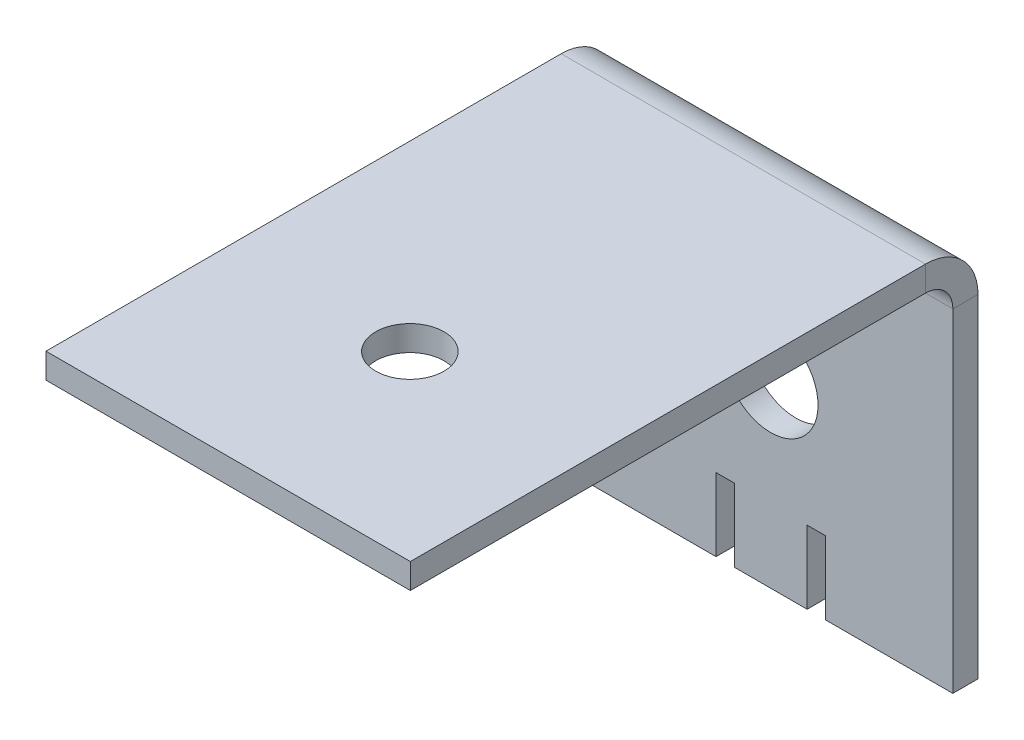
from build123d import *

# Parameters (mm, degrees)
SKETCH1_W              = 25.4
SKETCH1_H              = 63.5
BASE_FLANGE1_DEPTH     = 1.7526
SKETCHED_BEND1_DEPTH   = 25.4
SKETCHED_BEND1_2_DEPTH = 25.4
CUT_EXTRUDE2_REACH     = 54.894
SKETCH9_R              = 3.302
SKETCH9_W              = 1.27
SKETCH9_H              = 5.08
SKETCH10_W             = 5.08
SKETCH10_H             = 5.08
BOSS_EXTRUDE1_DEPTH    = 1.7526
CUT_EXTRUDE3_REACH     = 54.894
SKETCH11_R             = 2.38125


# Read off the part's stored shape, not the designer's step: Sketched Bend1
# Sheet-metal steps are written as plain solids
with BuildPart() as part:
    # Sketch1 → Base-Flange1 (new body)
    with BuildSketch(Plane.XY):
        with Locations((12.7, 31.75)):
            Rectangle(SKETCH1_W, SKETCH1_H)
    extrude(amount=-BASE_FLANGE1_DEPTH)

    # Sketched Bend1 outline → Sketched Bend1 (cut)
    with BuildSketch(Plane.YZ):
        with BuildLine():
            Line((63.5, 0), (26.337912998, 0))
            ThreePointArc((26.337912998, 0), (25.005866723, -1.284495709), (23.215572088, -1.7526))
            Line((23.215572088, -1.7526), (63.5, -1.7526))
            Line((63.5, -1.7526), (63.5, 0))
        make_face()
    extrude(amount=SKETCHED_BEND1_DEPTH, mode=Mode.SUBTRACT)

    # Sketched Bend1 2 outline → Sketched Bend1 2 (add)
    with BuildSketch(Plane.YZ):
        with BuildLine():
            Line((25.120572088, 37.820572088), (25.120572088, 1.905))
            ThreePointArc((25.120572088, 1.905), (24.562610506, 0.557961582), (23.215572088, 0))
            Line((23.215572088, 0), (26.337912998, 0))
            ThreePointArc((26.337912998, 0), (26.736815609, 0.915615432), (26.873172088, 1.905))
            Line((26.873172088, 1.905), (26.873172088, 37.820572088))
            Line((26.873172088, 37.820572088), (25.120572088, 37.820572088))
        make_face()
    extrude(amount=SKETCHED_BEND1_2_DEPTH)

    # Sketch9 → Cut-Extrude2 (cut, up to next)
    with BuildSketch(Plane.XY, mode=Mode.PRIVATE) as cut_extrude2_sk1:
        with Locations((12.7, 12.7)):
            Circle(SKETCH9_R)
    cut_extrude2_tool1 = extrude(cut_extrude2_sk1.sketch, amount=-CUT_EXTRUDE2_REACH, mode=Mode.PRIVATE) & part.part
    # Sketch9 → Cut-Extrude2 (cut, up to next)
    with BuildSketch(Plane.XY, mode=Mode.PRIVATE) as cut_extrude2_sk2:
        with Locations((15.875, 2.54)):
            Rectangle(SKETCH9_W, SKETCH9_H)
    cut_extrude2_tool2 = extrude(cut_extrude2_sk2.sketch, amount=-CUT_EXTRUDE2_REACH, mode=Mode.PRIVATE) & part.part
    # Sketch9 → Cut-Extrude2 (cut, up to next)
    with BuildSketch(Plane.XY, mode=Mode.PRIVATE) as cut_extrude2_sk3:
        with Locations((9.525, 2.54)):
            Rectangle(SKETCH9_W, SKETCH9_H)
    cut_extrude2_tool3 = extrude(cut_extrude2_sk3.sketch, amount=-CUT_EXTRUDE2_REACH, mode=Mode.PRIVATE) & part.part
    add(cut_extrude2_tool1.solids().sort_by_distance((12.7, 12.7, 0))[0], mode=Mode.SUBTRACT)
    add(cut_extrude2_tool2.solids().sort_by_distance((15.875, 2.54, 0))[0], mode=Mode.SUBTRACT)
    add(cut_extrude2_tool3.solids().sort_by_distance((9.525, 2.54, 0))[0], mode=Mode.SUBTRACT)

    # Sketch10 → Boss-Extrude1 (add)
    with BuildSketch(Plane.XY):
        with Locations((-2.54, 12.7)):
            Rectangle(SKETCH10_W, SKETCH10_H)
    extrude(amount=-BOSS_EXTRUDE1_DEPTH)

    # Sketch11 → Cut-Extrude3 (cut, up to next)
    with BuildSketch(Plane(origin=(0, 26.873172088, 0), x_dir=(1, 0, 0), z_dir=(0, 1, 0)), mode=Mode.PRIVATE) as cut_extrude3_sk1:
        with Locations(Location((12.7, -25.154382, 0), (0, 0, 270))):
            Circle(SKETCH11_R)
    cut_extrude3_tool1 = extrude(cut_extrude3_sk1.sketch, amount=-CUT_EXTRUDE3_REACH, mode=Mode.PRIVATE) & part.part
    add(cut_extrude3_tool1.solids().sort_by_distance((12.7, 26.873172, 25.154382))[0], mode=Mode.SUBTRACT)


solid = part.part
